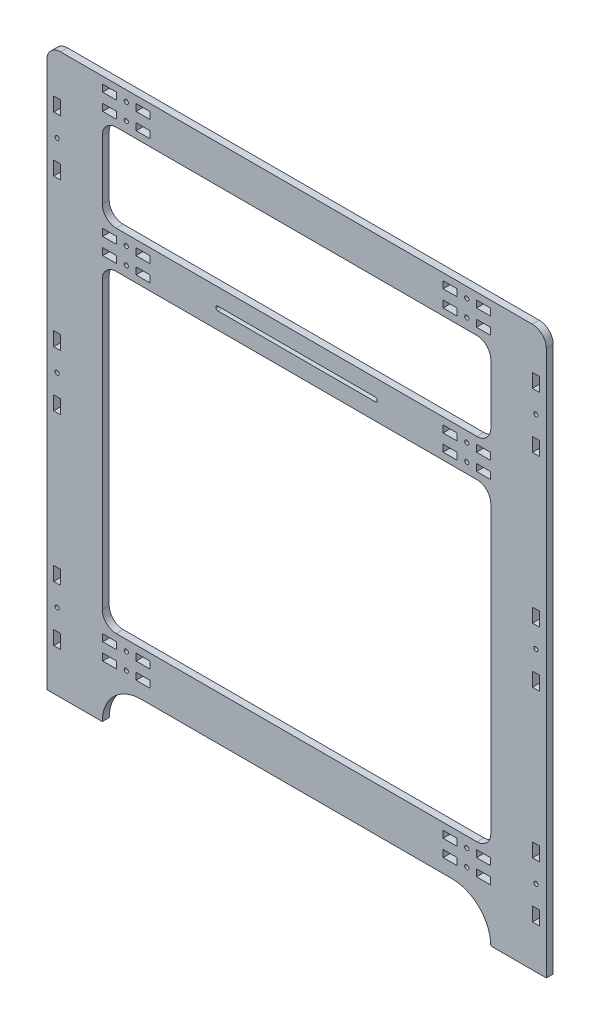
from build123d import *

# Parameters (mm, degrees)
SKETCH1_SIDE_SKETCH_2_W   = 5
SKETCH1_SIDE_SKETCH_2_H   = 10
SKETCH1_SIDE_SKETCH_2_W_2 = 10
SKETCH1_SIDE_SKETCH_2_H_2 = 5
SKETCH1_SIDE_SKETCH_2_R   = 1.5
BOSS_EXTRUDE1_DEPTH       = 5


with BuildPart() as part:
    # Sketch1-Side Sketch<2> → Boss-Extrude1 (new body)
    with BuildSketch(Plane.XY):
        with BuildLine():
            Line((170, 100), (-170, 100))
            ThreePointArc((-170, 100), (-177.071067812, 97.071067812), (-180, 90))
            Line((-180, 90), (-180, -303))
            Line((-180, -303), (-140, -303))
            ThreePointArc((-140, -303), (-131.798989873, -283.201010127), (-112, -275))
            Line((-112, -275), (112, -275))
            ThreePointArc((112, -275), (131.798989873, -283.201010127), (140, -303))
            Line((140, -303), (180, -303))
            Line((180, -303), (180, 90))
            ThreePointArc((180, 90), (177.071067812, 97.071067812), (170, 100))
        make_face()
        with Locations((172.5, 65)):
            Rectangle(SKETCH1_SIDE_SKETCH_2_W, SKETCH1_SIDE_SKETCH_2_H, mode=Mode.SUBTRACT)
        with Locations((172.5, 25)):
            Rectangle(SKETCH1_SIDE_SKETCH_2_W, SKETCH1_SIDE_SKETCH_2_H, mode=Mode.SUBTRACT)
        with Locations((172.5, -81.5)):
            Rectangle(SKETCH1_SIDE_SKETCH_2_W, SKETCH1_SIDE_SKETCH_2_H, mode=Mode.SUBTRACT)
        with Locations((172.5, -121.5)):
            Rectangle(SKETCH1_SIDE_SKETCH_2_W, SKETCH1_SIDE_SKETCH_2_H, mode=Mode.SUBTRACT)
        with Locations((172.5, -228)):
            Rectangle(SKETCH1_SIDE_SKETCH_2_W, SKETCH1_SIDE_SKETCH_2_H, mode=Mode.SUBTRACT)
        with Locations((172.5, -268)):
            Rectangle(SKETCH1_SIDE_SKETCH_2_W, SKETCH1_SIDE_SKETCH_2_H, mode=Mode.SUBTRACT)
        with Locations((-172.5, -268)):
            Rectangle(SKETCH1_SIDE_SKETCH_2_W, SKETCH1_SIDE_SKETCH_2_H, mode=Mode.SUBTRACT)
        with Locations((-172.5, -228)):
            Rectangle(SKETCH1_SIDE_SKETCH_2_W, SKETCH1_SIDE_SKETCH_2_H, mode=Mode.SUBTRACT)
        with Locations((-172.5, -121.5)):
            Rectangle(SKETCH1_SIDE_SKETCH_2_W, SKETCH1_SIDE_SKETCH_2_H, mode=Mode.SUBTRACT)
        with Locations((-172.5, -81.5)):
            Rectangle(SKETCH1_SIDE_SKETCH_2_W, SKETCH1_SIDE_SKETCH_2_H, mode=Mode.SUBTRACT)
        with Locations((-172.5, 25)):
            Rectangle(SKETCH1_SIDE_SKETCH_2_W, SKETCH1_SIDE_SKETCH_2_H, mode=Mode.SUBTRACT)
        with Locations((-172.5, 65)):
            Rectangle(SKETCH1_SIDE_SKETCH_2_W, SKETCH1_SIDE_SKETCH_2_H, mode=Mode.SUBTRACT)
        with Locations((-134.71277016, -262.5)):
            Rectangle(SKETCH1_SIDE_SKETCH_2_W_2, SKETCH1_SIDE_SKETCH_2_H_2, mode=Mode.SUBTRACT)
        with Locations((-122.683026536, -262.5)):
            Circle(SKETCH1_SIDE_SKETCH_2_R, mode=Mode.SUBTRACT)
        with Locations((-110.653282912, -262.5)):
            Rectangle(SKETCH1_SIDE_SKETCH_2_W_2, SKETCH1_SIDE_SKETCH_2_H_2, mode=Mode.SUBTRACT)
        with Locations((-134.71277016, -250.5)):
            Rectangle(SKETCH1_SIDE_SKETCH_2_W_2, SKETCH1_SIDE_SKETCH_2_H_2, mode=Mode.SUBTRACT)
        with Locations((-122.683026536, -250.5)):
            Circle(SKETCH1_SIDE_SKETCH_2_R, mode=Mode.SUBTRACT)
        with Locations((-110.653282912, -250.5)):
            Rectangle(SKETCH1_SIDE_SKETCH_2_W_2, SKETCH1_SIDE_SKETCH_2_H_2, mode=Mode.SUBTRACT)
        with Locations((110.653282912, -262.5)):
            Rectangle(SKETCH1_SIDE_SKETCH_2_W_2, SKETCH1_SIDE_SKETCH_2_H_2, mode=Mode.SUBTRACT)
        with Locations((122.683026536, -262.5)):
            Circle(SKETCH1_SIDE_SKETCH_2_R, mode=Mode.SUBTRACT)
        with Locations((134.71277016, -262.5)):
            Rectangle(SKETCH1_SIDE_SKETCH_2_W_2, SKETCH1_SIDE_SKETCH_2_H_2, mode=Mode.SUBTRACT)
        with Locations((110.653282912, -250.5)):
            Rectangle(SKETCH1_SIDE_SKETCH_2_W_2, SKETCH1_SIDE_SKETCH_2_H_2, mode=Mode.SUBTRACT)
        with Locations((122.683026536, -250.5)):
            Circle(SKETCH1_SIDE_SKETCH_2_R, mode=Mode.SUBTRACT)
        with Locations((134.71277016, -250.5)):
            Rectangle(SKETCH1_SIDE_SKETCH_2_W_2, SKETCH1_SIDE_SKETCH_2_H_2, mode=Mode.SUBTRACT)
        with BuildLine():
            Line((-130, -17), (130, -17))
            ThreePointArc((130, -17), (137.071067812, -19.928932188), (140, -27))
            Line((140, -27), (140, -233))
            ThreePointArc((140, -233), (137.071067812, -240.071067812), (130, -243))
            Line((130, -243), (-130, -243))
            ThreePointArc((-130, -243), (-137.071067812, -240.071067812), (-140, -233))
            Line((-140, -233), (-140, -27))
            ThreePointArc((-140, -27), (-137.071067812, -19.928932188), (-130, -17))
        make_face(mode=Mode.SUBTRACT)
        with Locations((-134.71277016, -9.5)):
            Rectangle(SKETCH1_SIDE_SKETCH_2_W_2, SKETCH1_SIDE_SKETCH_2_H_2, mode=Mode.SUBTRACT)
        with Locations((-122.683026536, -9.5)):
            Circle(SKETCH1_SIDE_SKETCH_2_R, mode=Mode.SUBTRACT)
        with Locations((-110.653282912, -9.5)):
            Rectangle(SKETCH1_SIDE_SKETCH_2_W_2, SKETCH1_SIDE_SKETCH_2_H_2, mode=Mode.SUBTRACT)
        with Locations((-134.71277016, 2.5)):
            Rectangle(SKETCH1_SIDE_SKETCH_2_W_2, SKETCH1_SIDE_SKETCH_2_H_2, mode=Mode.SUBTRACT)
        with Locations((-122.683026536, 2.5)):
            Circle(SKETCH1_SIDE_SKETCH_2_R, mode=Mode.SUBTRACT)
        with Locations((-110.653282912, 2.5)):
            Rectangle(SKETCH1_SIDE_SKETCH_2_W_2, SKETCH1_SIDE_SKETCH_2_H_2, mode=Mode.SUBTRACT)
        with Locations((-134.71277016, 80.5)):
            Rectangle(SKETCH1_SIDE_SKETCH_2_W_2, SKETCH1_SIDE_SKETCH_2_H_2, mode=Mode.SUBTRACT)
        with Locations((-122.683026536, 80.5)):
            Circle(SKETCH1_SIDE_SKETCH_2_R, mode=Mode.SUBTRACT)
        with Locations((-134.71277016, 92.5)):
            Rectangle(SKETCH1_SIDE_SKETCH_2_W_2, SKETCH1_SIDE_SKETCH_2_H_2, mode=Mode.SUBTRACT)
        with Locations((-122.683026536, 92.5)):
            Circle(SKETCH1_SIDE_SKETCH_2_R, mode=Mode.SUBTRACT)
        with Locations((-110.653282912, 80.5)):
            Rectangle(SKETCH1_SIDE_SKETCH_2_W_2, SKETCH1_SIDE_SKETCH_2_H_2, mode=Mode.SUBTRACT)
        with Locations((-110.653282912, 92.5)):
            Rectangle(SKETCH1_SIDE_SKETCH_2_W_2, SKETCH1_SIDE_SKETCH_2_H_2, mode=Mode.SUBTRACT)
        with BuildLine():
            Line((-130, 73), (130, 73))
            ThreePointArc((130, 73), (137.071067812, 70.071067812), (140, 63))
            Line((140, 63), (140, 20))
            ThreePointArc((140, 20), (137.071067812, 12.928932188), (130, 10))
            Line((130, 10), (-130, 10))
            ThreePointArc((-130, 10), (-137.071067812, 12.928932188), (-140, 20))
            Line((-140, 20), (-140, 63))
            ThreePointArc((-140, 63), (-137.071067812, 70.071067812), (-130, 73))
        make_face(mode=Mode.SUBTRACT)
        with BuildLine():
            ThreePointArc((-56.666666667, -5), (-58.166666667, -3.5), (-56.666666667, -2))
            Line((-56.666666667, -2), (56.666666667, -2))
            ThreePointArc((56.666666667, -2), (58.166666667, -3.5), (56.666666667, -5))
            Line((56.666666667, -5), (-56.666666667, -5))
        make_face(mode=Mode.SUBTRACT)
        with Locations((110.653282912, -9.5)):
            Rectangle(SKETCH1_SIDE_SKETCH_2_W_2, SKETCH1_SIDE_SKETCH_2_H_2, mode=Mode.SUBTRACT)
        with Locations((122.683026536, -9.5)):
            Circle(SKETCH1_SIDE_SKETCH_2_R, mode=Mode.SUBTRACT)
        with Locations((134.71277016, -9.5)):
            Rectangle(SKETCH1_SIDE_SKETCH_2_W_2, SKETCH1_SIDE_SKETCH_2_H_2, mode=Mode.SUBTRACT)
        with Locations((110.653282912, 2.5)):
            Rectangle(SKETCH1_SIDE_SKETCH_2_W_2, SKETCH1_SIDE_SKETCH_2_H_2, mode=Mode.SUBTRACT)
        with Locations((122.683026536, 2.5)):
            Circle(SKETCH1_SIDE_SKETCH_2_R, mode=Mode.SUBTRACT)
        with Locations((134.71277016, 2.5)):
            Rectangle(SKETCH1_SIDE_SKETCH_2_W_2, SKETCH1_SIDE_SKETCH_2_H_2, mode=Mode.SUBTRACT)
        with Locations((110.653282912, 80.5)):
            Rectangle(SKETCH1_SIDE_SKETCH_2_W_2, SKETCH1_SIDE_SKETCH_2_H_2, mode=Mode.SUBTRACT)
        with Locations((110.653282912, 92.5)):
            Rectangle(SKETCH1_SIDE_SKETCH_2_W_2, SKETCH1_SIDE_SKETCH_2_H_2, mode=Mode.SUBTRACT)
        with Locations((122.683026536, 80.5)):
            Circle(SKETCH1_SIDE_SKETCH_2_R, mode=Mode.SUBTRACT)
        with Locations((134.71277016, 80.5)):
            Rectangle(SKETCH1_SIDE_SKETCH_2_W_2, SKETCH1_SIDE_SKETCH_2_H_2, mode=Mode.SUBTRACT)
        with Locations((122.683026536, 92.5)):
            Circle(SKETCH1_SIDE_SKETCH_2_R, mode=Mode.SUBTRACT)
        with Locations((134.71277016, 92.5)):
            Rectangle(SKETCH1_SIDE_SKETCH_2_W_2, SKETCH1_SIDE_SKETCH_2_H_2, mode=Mode.SUBTRACT)
        with Locations((172.5, -101.5)):
            Circle(SKETCH1_SIDE_SKETCH_2_R, mode=Mode.SUBTRACT)
        with Locations((172.5, 45)):
            Circle(SKETCH1_SIDE_SKETCH_2_R, mode=Mode.SUBTRACT)
        with Locations((172.5, -248)):
            Circle(SKETCH1_SIDE_SKETCH_2_R, mode=Mode.SUBTRACT)
        with Locations((-172.5, -248)):
            Circle(SKETCH1_SIDE_SKETCH_2_R, mode=Mode.SUBTRACT)
        with Locations((-172.5, -101.5)):
            Circle(SKETCH1_SIDE_SKETCH_2_R, mode=Mode.SUBTRACT)
        with Locations((-172.5, 45)):
            Circle(SKETCH1_SIDE_SKETCH_2_R, mode=Mode.SUBTRACT)
    extrude(amount=BOSS_EXTRUDE1_DEPTH)


solid = part.part
